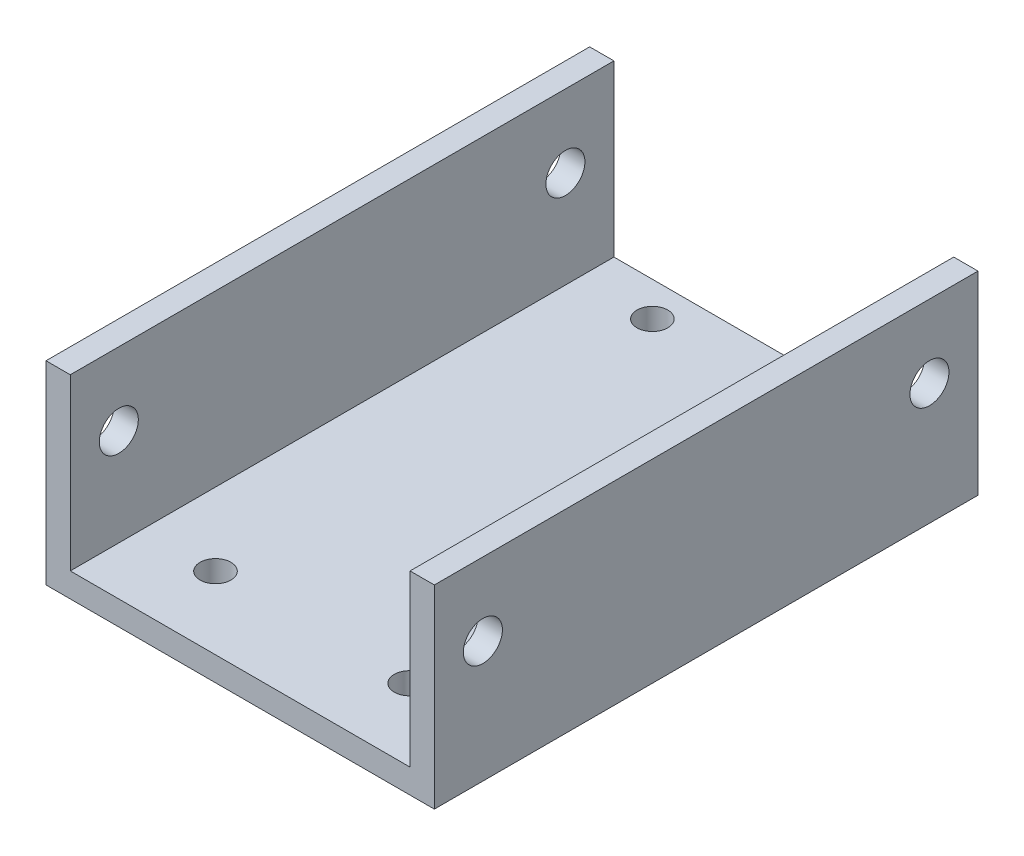
from build123d import *

# Parameters (mm, degrees)
BOSS_EXTRUDE1_DEPTH = 71.12
CUT_EXTRUDE1_REACH  = 92.181
SKETCH2_R           = 2.0193
SKETCH3_R           = 2.5527
CUT_EXTRUDE2_DEPTH  = 92.015682165


with BuildPart() as part:
    # Sketch1 → Boss-Extrude1 (new body)
    with BuildSketch(Plane.XY):
        Polygon((47.625, 3.175), (47.625, 25.4), (50.8, 25.4), (50.8, 0), (0, 0), (0, 25.4), (3.175, 25.4), (3.175, 3.175), align=None)
    extrude(amount=BOSS_EXTRUDE1_DEPTH)

    # Sketch2 → Cut-Extrude1 (cut, up to next)
    with BuildSketch(Plane(origin=(0, 3.175, 0), x_dir=(1, 0, 0), z_dir=(0, 1, 0)), mode=Mode.PRIVATE) as cut_extrude1_sk1:
        with Locations((38.1, -4.4975)):
            Circle(SKETCH2_R)
    cut_extrude1_tool1 = extrude(cut_extrude1_sk1.sketch, amount=-CUT_EXTRUDE1_REACH, mode=Mode.PRIVATE) & part.part
    # Sketch2 → Cut-Extrude1 (cut, up to next)
    with BuildSketch(Plane(origin=(0, 3.175, 0), x_dir=(1, 0, 0), z_dir=(0, 1, 0)), mode=Mode.PRIVATE) as cut_extrude1_sk2:
        with Locations((38.1, -61.6475)):
            Circle(SKETCH2_R)
    cut_extrude1_tool2 = extrude(cut_extrude1_sk2.sketch, amount=-CUT_EXTRUDE1_REACH, mode=Mode.PRIVATE) & part.part
    # Sketch2 → Cut-Extrude1 (cut, up to next)
    with BuildSketch(Plane(origin=(0, 3.175, 0), x_dir=(1, 0, 0), z_dir=(0, 1, 0)), mode=Mode.PRIVATE) as cut_extrude1_sk3:
        with Locations((12.7, -4.4975)):
            Circle(SKETCH2_R)
    cut_extrude1_tool3 = extrude(cut_extrude1_sk3.sketch, amount=-CUT_EXTRUDE1_REACH, mode=Mode.PRIVATE) & part.part
    # Sketch2 → Cut-Extrude1 (cut, up to next)
    with BuildSketch(Plane(origin=(0, 3.175, 0), x_dir=(1, 0, 0), z_dir=(0, 1, 0)), mode=Mode.PRIVATE) as cut_extrude1_sk4:
        with Locations((12.7, -61.6475)):
            Circle(SKETCH2_R)
    cut_extrude1_tool4 = extrude(cut_extrude1_sk4.sketch, amount=-CUT_EXTRUDE1_REACH, mode=Mode.PRIVATE) & part.part
    add(cut_extrude1_tool1.solids().sort_by_distance((38.1, 3.175, 4.4975))[0], mode=Mode.SUBTRACT)
    add(cut_extrude1_tool2.solids().sort_by_distance((38.1, 3.175, 61.6475))[0], mode=Mode.SUBTRACT)
    add(cut_extrude1_tool3.solids().sort_by_distance((12.7, 3.175, 4.4975))[0], mode=Mode.SUBTRACT)
    add(cut_extrude1_tool4.solids().sort_by_distance((12.7, 3.175, 61.6475))[0], mode=Mode.SUBTRACT)

    # Sketch3 → Cut-Extrude2 (cut, through all)
    with BuildSketch(Plane(origin=(50.8, 0, 0), x_dir=(0, 0, -1), z_dir=(1, 0, 0))):
        with Locations((-6.35, 15.875)):
            Circle(SKETCH3_R)
        with Locations((-64.77, 15.875)):
            Circle(SKETCH3_R)
    extrude(amount=-CUT_EXTRUDE2_DEPTH, mode=Mode.SUBTRACT)


solid = part.part
